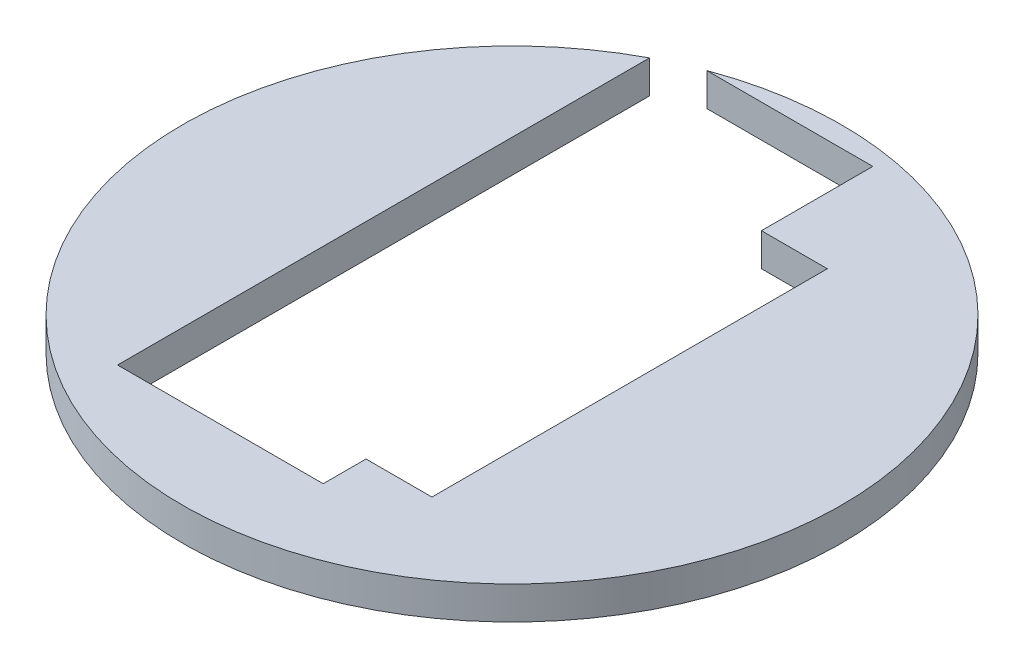
from build123d import *

# Parameters (mm, degrees)
SKETCH1_R           = 47.625
BOSS_EXTRUDE1_DEPTH = 12.7
SKETCH2_R           = 47.625
BOSS_EXTRUDE4_DEPTH = 12.7
BOSS_EXTRUDE5_DEPTH = 4.7625
SKETCH14_W          = 19.812
SKETCH14_H          = 52.959
CUT_EXTRUDE11_DEPTH = 9.275815586
BOSS_EXTRUDE7_DEPTH = 3.175


with BuildPart() as part:
    # Sketch1 → Boss-Extrude1 (new body)
    with BuildSketch(Plane(origin=(0, 0, 0), x_dir=(1, 0, 0), z_dir=(0, 1, 0))):
        Circle(SKETCH1_R)
    extrude(amount=-BOSS_EXTRUDE1_DEPTH)

    # Sketch14 → Cut-Extrude11 (cut)
    with BuildSketch(Plane.XZ.offset(12.7)):
        with Locations((-4.92125, -3.302)):
            Rectangle(SKETCH14_W, SKETCH14_H)
    extrude(amount=-CUT_EXTRUDE11_DEPTH, mode=Mode.SUBTRACT)


with BuildPart() as body_2:
    # Sketch2 → Boss-Extrude4 (new body)
    with BuildSketch(Plane(origin=(0, 0, 0), x_dir=(1, 0, 0), z_dir=(0, 1, 0))):
        Circle(SKETCH2_R)
        with BuildLine():
            Line((30.48, 5.08), (26.035, 5.08))
            Line((26.035, 5.08), (26.035, -36.027507199))
            ThreePointArc((26.035, -36.027507199), (0, -44.45), (-26.035, -36.027507199))
            Line((-26.035, -36.027507199), (-26.035, 5.08))
            Line((-26.035, 5.08), (-30.48, 5.08))
            Line((-30.48, 5.08), (-30.48, -32.353857575))
            ThreePointArc((-30.48, -32.353857575), (-43.961440483, 6.572233308), (-19.685, 39.853522743))
            Line((-19.685, 39.853522743), (-19.685, 25.0825))
            Line((-19.685, 25.0825), (-15.24, 25.0825))
            Line((-15.24, 25.0825), (-15.24, 41.755776846))
            ThreePointArc((-15.24, 41.755776846), (0, 44.45), (15.24, 41.755776846))
            Line((15.24, 41.755776846), (15.24, 25.0825))
            Line((15.24, 25.0825), (19.685, 25.0825))
            Line((19.685, 25.0825), (19.685, 39.853522743))
            ThreePointArc((19.685, 39.853522743), (43.961440483, 6.572233308), (30.48, -32.353857575))
            Line((30.48, -32.353857575), (30.48, 5.08))
        make_face(mode=Mode.SUBTRACT)
    extrude(amount=BOSS_EXTRUDE4_DEPTH)


with BuildPart() as body_3:
    # Sketch10 → Boss-Extrude5 (new body)
    with BuildSketch(Plane(origin=(0, 0, 0), x_dir=(1, 0, 0), z_dir=(0, 1, 0))):
        with BuildLine():
            ThreePointArc((4.7625, -44.19412963), (7.475442585, -43.816894666), (10.16, -43.273281595))
            Line((10.16, -43.273281595), (10.16, 43.273281595))
            ThreePointArc((10.16, 43.273281595), (7.475442585, 43.816894666), (4.7625, 44.19412963))
            Line((4.7625, 44.19412963), (4.7625, -44.19412963))
        make_face()
    extrude(amount=BOSS_EXTRUDE5_DEPTH)


with BuildPart() as body_4:
    # Sketch18 → Boss-Extrude7 (new body)
    with BuildSketch(Plane.XZ.offset(12.7)):
        with BuildLine():
            Line((-14.82725, 23.1775), (4.98475, 23.1775))
            Line((4.98475, 23.1775), (4.98475, 19.05))
            Line((4.98475, 19.05), (11.33475, 19.05))
            Line((11.33475, 19.05), (11.33475, -19.05))
            Line((11.33475, -19.05), (4.98475, -19.05))
            Line((4.98475, -19.05), (4.98475, -29.7815))
            Line((4.98475, -29.7815), (-11.005669346, -29.7815))
            ThreePointArc((-11.005669346, -29.7815), (12.944605873, 28.991372489), (-14.82725, -28.075169767))
            Line((-14.82725, -28.075169767), (-14.82725, 23.1775))
        make_face()
    extrude(amount=BOSS_EXTRUDE7_DEPTH)


solid = body_4.part
